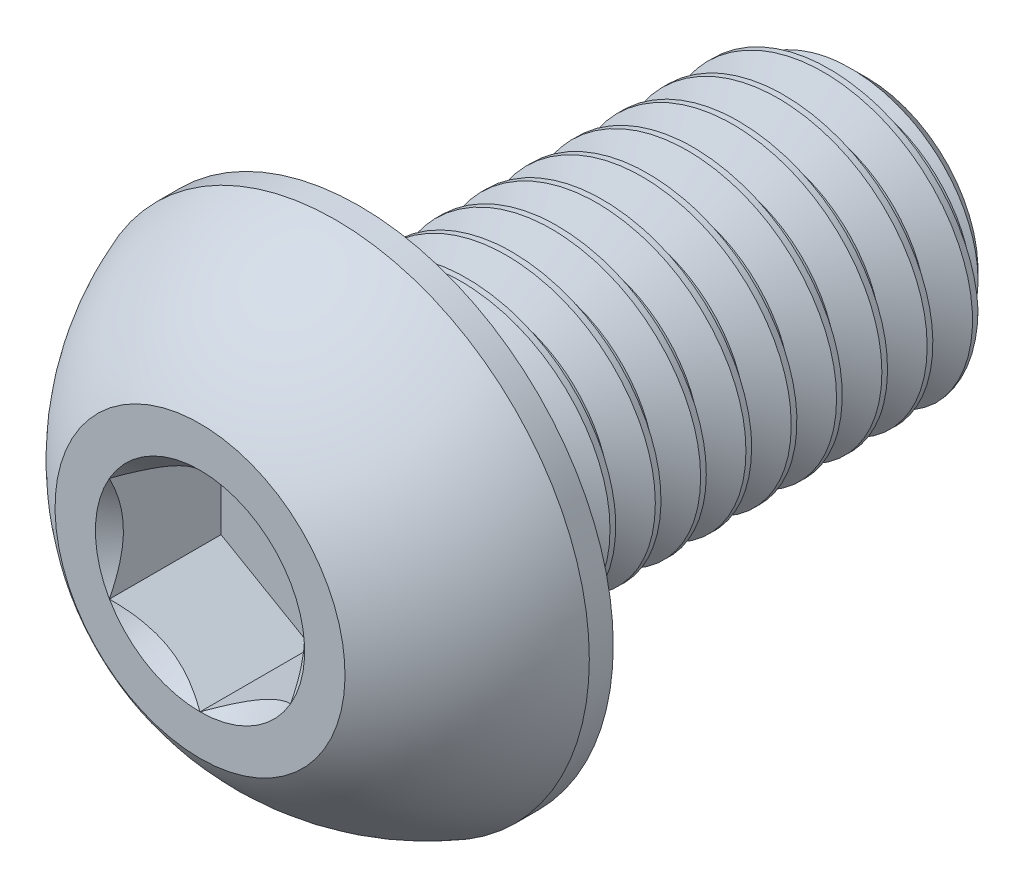
from build123d import *

# Parameters (mm, degrees)
SKETCH1_W          = 14
SKETCH1_H          = 4
CHAMFER1_SIZE      = 0.9375
CUT_SWEEP1_PITCH   = 1.25
CUT_EXTRUDE2_DEPTH = 3.08


with BuildPart() as part:
    # Sketch1 → Revolve1 (revolve)
    with BuildSketch(Plane(origin=(0, 0, 0), x_dir=(0, 0, -1), z_dir=(1, 0, 0))):
        with Locations((11.4, 2)):
            Rectangle(SKETCH1_W, SKETCH1_H)
    revolve(axis=Axis((0, 0, -18.4), (0, 0, 1)))

    # Chamfer1
    chamfer1_edges = [part.edges().sort_by_distance(p)[0] for p in [
        (0, -4, -18.4),
    ]]
    chamfer(chamfer1_edges, length=CHAMFER1_SIZE)

    # Cut-Sweep1: the profile of Sketch2 profile screwed along a right-hand helix of 12.2 turns, 8 arcs to a turn; built about Z, then put on its axis
    cut_sweep1_z = Axis((0, 0, 0), (0, 0, 1))
    cut_sweep1_corners = [(4.0003, 0, 0.000173205), (4.0003, 0, -1.093923205), (3.188101184, 0, -0.625), (3.188101184, 0, -0.46875)]
    with BuildLine(mode=Mode.PRIVATE) as cut_sweep1_profile:
        Line(cut_sweep1_corners[0], cut_sweep1_corners[1])
        Line(cut_sweep1_corners[1], cut_sweep1_corners[2])
        Line(cut_sweep1_corners[2], cut_sweep1_corners[3])
        Line(cut_sweep1_corners[3], cut_sweep1_corners[0])
    cut_sweep1_cap = Face(cut_sweep1_profile.wire())
    cut_sweep1_turn_angles = [0, 22.5, 45, 67.5, 90, 112.5, 135, 157.5, 180, 202.5, 225, 247.5, 270, 292.5, 315, 337.5, 360]
    cut_sweep1_turn_weights = [1, 0.9238795325112867, 1, 0.9238795325112867, 1, 0.9238795325112867, 1, 0.9238795325112867, 1, 0.9238795325112867, 1, 0.9238795325112867, 1, 0.9238795325112867, 1, 0.9238795325112867, 1]
    cut_sweep1_turn_rails = [Edge.make_bspline([Vector(p[0], p[1], 0).rotate(cut_sweep1_z, cut_sweep1_turn_angles[k]) / cut_sweep1_turn_weights[k] + Vector(0, 0, p[2] + CUT_SWEEP1_PITCH * cut_sweep1_turn_angles[k] / 360) for k in range(17)], [0, 0, 0, 1, 1, 2, 2, 3, 3, 4, 4, 5, 5, 6, 6, 7, 7, 8, 8, 8], 2, cut_sweep1_turn_weights) for p in cut_sweep1_corners]
    cut_sweep1_turn_sides = [Face.make_surface_from_curves(cut_sweep1_turn_rails[p[0]], cut_sweep1_turn_rails[p[1]]) for p in [(0, 1), (1, 2), (2, 3), (3, 0)]]
    cut_sweep1_last_angles = [4320, 4342.5, 4365, 4378.5, 4392]
    cut_sweep1_last_weights = [1, 0.9238795325112867, 1, 0.9723699203976748, 1]
    cut_sweep1_last_rails = [Edge.make_bspline([Vector(p[0], p[1], 0).rotate(cut_sweep1_z, cut_sweep1_last_angles[k]) / cut_sweep1_last_weights[k] + Vector(0, 0, p[2] + CUT_SWEEP1_PITCH * cut_sweep1_last_angles[k] / 360) for k in range(5)], [0, 0, 0, 1, 1, 2, 2, 2], 2, cut_sweep1_last_weights) for p in cut_sweep1_corners]
    cut_sweep1_last_sides = [Face.make_surface_from_curves(cut_sweep1_last_rails[p[0]], cut_sweep1_last_rails[p[1]]) for p in [(0, 1), (1, 2), (2, 3), (3, 0)]]
    cut_sweep1 = Plane(origin=(0, 0, -18.4), x_dir=(0, 1, 0), z_dir=(0, 0, 1)) * Solid(Shell([*[p.moved(Location((0, 0, CUT_SWEEP1_PITCH * i))) for i in range(12) for p in cut_sweep1_turn_sides], *cut_sweep1_last_sides, cut_sweep1_cap, cut_sweep1_cap.rotate(cut_sweep1_z, 4392).moved(Location((0, 0, CUT_SWEEP1_PITCH * 4392 / 360)))]))
    add(cut_sweep1, mode=Mode.SUBTRACT)

    # Sketch7 → Revolve2 (revolve)
    with BuildSketch(Plane(origin=(0, 0, 0), x_dir=(0, 0, -1), z_dir=(1, 0, 0)), mode=Mode.PRIVATE) as revolve2_sk:
        with BuildLine():
            Line((3.74, 7), (4.4, 7))
            Line((4.4, 7), (4.4, 0))
            Line((4.4, 0), (0, 0))
            Line((0, 0), (0, 4))
            ThreePointArc((0, 4), (1.621972026, 5.809208208), (3.74, 7))
        make_face()
    revolve(revolve2_sk.sketch.rotate(Axis((0, 0, 0), (0, 0, -1)), 189.052465709), axis=Axis((0, 0, 0), (0, 0, -1)))

    # Sketch5 → Cut-Extrude2 (cut)
    with BuildSketch(Plane.XY):
        Polygon((2.5, -1.443375673), (2.5, 1.443375673), (0, 2.886751346), (-2.5, 1.443375673), (-2.5, -1.443375673), (0, -2.886751346), align=None)
    extrude(amount=-CUT_EXTRUDE2_DEPTH, mode=Mode.SUBTRACT)

    # Cut-Extrude3 cone 1 section (through the dimple's axis) → Cut-Extrude3 (revolve, cut)
    with BuildSketch(Plane(origin=(0, 0, 0), x_dir=(0, -1, 0), z_dir=(1, 0, 0))):
        Polygon((0, 0), (2.886751346, 0), (0, 2.886751346), align=None)
    revolve(axis=Axis((0, 0, 0), (0, 0, -1)), mode=Mode.SUBTRACT)


solid = part.part
